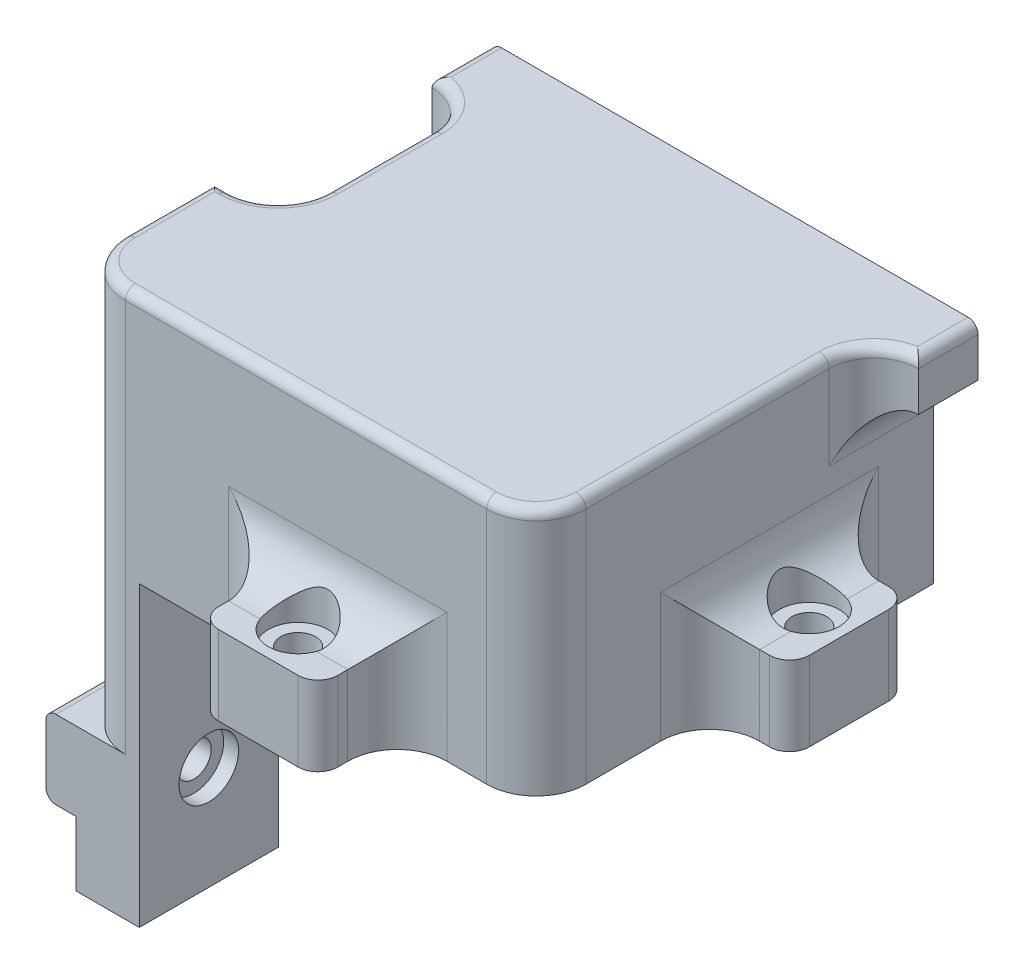
from build123d import *

# Parameters (mm, degrees)
CROQUIS1_W              = 40
CROQUIS1_H              = 40
SALIENTE_EXTRUIR1_DEPTH = 25
CROQUIS3_W              = 30
CROQUIS3_H              = 18
CORTAR_EXTRUIR1_DEPTH   = 30
CROQUIS4_W              = 9
CROQUIS4_H              = 10
SALIENTE_EXTRUIR2_DEPTH = 5
REDONDEO3_R             = 4.5
CROQUIS6_W              = 6.4
CROQUIS6_H              = 14
SALIENTE_EXTRUIR3_DEPTH = 55
CROQUIS7_W              = 14
CROQUIS7_H              = 7.9
SALIENTE_EXTRUIR4_DEPTH = 3
CROQUIS8_R              = 1.75
CORTAR_EXTRUIR2_DEPTH   = 9.4
CROQUIS9_R              = 3
CORTAR_EXTRUIR3_DEPTH   = 1.5
REDONDEO4_R             = 1
CROQUIS10_W             = 8
CROQUIS10_H             = 12
CROQUIS10_W_2           = 12
CROQUIS10_H_2           = 8
SALIENTE_EXTRUIR5_DEPTH = 8
CROQUIS11_R             = 1.75
CORTAR_EXTRUIR4_DEPTH   = 8
CROQUIS12_R             = 3
CORTAR_EXTRUIR5_DEPTH   = 1.5
REDONDEO5_R             = 5
REDONDEO6_R             = 1
REDONDEO7_R             = 2
CROQUIS13_W             = 9
CROQUIS13_H             = 4
CORTAR_EXTRUIR6_DEPTH   = 85.308955633


# Some blends are built 0.0001 mm under size
with BuildPart() as part:
    # Croquis1 → Saliente-Extruir1 (new body)
    with BuildSketch(Plane(origin=(0, 0, 0), x_dir=(1, 0, 0), z_dir=(0, 1, 0))):
        with Locations((20, -20)):
            Rectangle(CROQUIS1_W, CROQUIS1_H)
    extrude(amount=SALIENTE_EXTRUIR1_DEPTH)

    # Croquis3 → Cortar-Extruir1 (cut)
    with BuildSketch(Plane(origin=(0, 0, 0), x_dir=(-1, 0, 0), z_dir=(0, 0, -1))):
        with Locations((-20, 12.5)):
            Rectangle(CROQUIS3_W, CROQUIS3_H)
    extrude(amount=-CORTAR_EXTRUIR1_DEPTH, mode=Mode.SUBTRACT)

    # Croquis4 → Saliente-Extruir2 (add)
    with BuildSketch(Plane(origin=(0, 25, 0), x_dir=(1, 0, 0), z_dir=(0, 1, 0))):
        with Locations((40, -1)):
            Rectangle(CROQUIS4_W, CROQUIS4_H)
        with Locations((0, -1)):
            Rectangle(CROQUIS4_W, CROQUIS4_H)
    extrude(amount=-SALIENTE_EXTRUIR2_DEPTH)

    # Redondeo3
    redondeo3_edges = [part.edges().sort_by_distance(p)[0] for p in [
        (0, 22.5, 6),
        (40, 22.5, 6),
        (0, 20, 3),
        (40, 20, 3),
    ]]
    fillet(redondeo3_edges, radius=REDONDEO3_R - 0.0001)  # a hair under: the kernel refuses the full size

    # Croquis6 → Saliente-Extruir3 (add)
    with BuildSketch(Plane(origin=(0, 25, 0), x_dir=(1, 0, 0), z_dir=(0, 1, 0))):
        with Locations((-3.2, -33)):
            Rectangle(CROQUIS6_W, CROQUIS6_H)
    extrude(amount=-SALIENTE_EXTRUIR3_DEPTH)

    # Croquis7 → Saliente-Extruir4 (add)
    with BuildSketch(Plane.ZY.offset(6.4)):
        with Locations((33, -19.55)):
            Rectangle(CROQUIS7_W, CROQUIS7_H)
    extrude(amount=SALIENTE_EXTRUIR4_DEPTH)

    # Croquis8 → Cortar-Extruir2 (cut)
    with BuildSketch(Plane.ZY.offset(9.4)):
        with Locations((33, -19.55)):
            Circle(CROQUIS8_R)
    extrude(amount=-CORTAR_EXTRUIR2_DEPTH, mode=Mode.SUBTRACT)

    # Croquis9 → Cortar-Extruir3 (cut)
    with BuildSketch(Plane(origin=(0, 0, 0), x_dir=(0, 0, -1), z_dir=(1, 0, 0))):
        with Locations((-33, -19.55)):
            Circle(CROQUIS9_R)
    extrude(amount=-CORTAR_EXTRUIR3_DEPTH, mode=Mode.SUBTRACT)

    # Redondeo4
    redondeo4_edges = [part.edges().sort_by_distance(p)[0] for p in [
        (-9.4, -23.5, 33),
        (-9.4, -15.6, 33),
    ]]
    fillet(redondeo4_edges, radius=REDONDEO4_R)

    # Croquis10 → Saliente-Extruir5 (add)
    with BuildSketch(Plane.XZ):
        with Locations((44, 16.5)):
            Rectangle(CROQUIS10_W, CROQUIS10_H)
        with Locations((20, 44)):
            Rectangle(CROQUIS10_W_2, CROQUIS10_H_2)
    extrude(amount=-SALIENTE_EXTRUIR5_DEPTH)

    # Croquis11 → Cortar-Extruir4 (cut)
    with BuildSketch(Plane.XZ):
        with Locations(Location((44, 16.5, 0), (0, 0, 270))):
            Circle(CROQUIS11_R)
        with Locations(Location((20, 44, 0), (0, 0, 270))):
            Circle(CROQUIS11_R)
    extrude(amount=-CORTAR_EXTRUIR4_DEPTH, mode=Mode.SUBTRACT)

    # Croquis12 → Cortar-Extruir5 (cut)
    with BuildSketch(Plane(origin=(0, 8, 0), x_dir=(1, 0, 0), z_dir=(0, 1, 0))):
        with Locations(Location((44, -16.5, 0), (0, 0, 270))):
            Circle(CROQUIS12_R)
        with Locations(Location((20, -44, 0), (0, 0, 270))):
            Circle(CROQUIS12_R)
    extrude(amount=-CORTAR_EXTRUIR5_DEPTH, mode=Mode.SUBTRACT)

    # Redondeo5
    # the kernel refuses this fillet: 5 mm, written as the material it adds along each edge
    with BuildSketch(Plane(origin=(0, 25, 26), x_dir=(-1, 0, 0), z_dir=(0, -1, 0))) as redondeo5_piece_1_section:
        with BuildLine():
            CenterArc((REDONDEO5_R, REDONDEO5_R), REDONDEO5_R, 180, 90)
            Line((0, REDONDEO5_R), (-REDONDEO5_R * 0.02, REDONDEO5_R))
            Line((-REDONDEO5_R * 0.02, REDONDEO5_R), (-REDONDEO5_R * 0.02, -REDONDEO5_R * 0.02))
            Line((-REDONDEO5_R * 0.02, -REDONDEO5_R * 0.02), (REDONDEO5_R, -REDONDEO5_R * 0.02))
            Line((REDONDEO5_R, -REDONDEO5_R * 0.02), (REDONDEO5_R, 0))
        make_face()
    redondeo5_piece_1 = extrude(amount=25, mode=Mode.PRIVATE)
    redondeo5_piece_1 = split(redondeo5_piece_1, bisect_by=Plane(origin=(0, 12.5, 24.982634351), z_dir=(-1, 0, 0)), keep=Keep.TOP, mode=Mode.PRIVATE)
    add(redondeo5_piece_1)
    with BuildSketch(Plane(origin=(40, 8, 22.5), x_dir=(0, 1, 0), z_dir=(0, 0, -1))) as redondeo5_piece_2_section:
        with BuildLine():
            CenterArc((REDONDEO5_R, REDONDEO5_R), REDONDEO5_R, 180, 90)
            Line((0, REDONDEO5_R), (-REDONDEO5_R * 0.02, REDONDEO5_R))
            Line((-REDONDEO5_R * 0.02, REDONDEO5_R), (-REDONDEO5_R * 0.02, -REDONDEO5_R * 0.02))
            Line((-REDONDEO5_R * 0.02, -REDONDEO5_R * 0.02), (REDONDEO5_R, -REDONDEO5_R * 0.02))
            Line((REDONDEO5_R, -REDONDEO5_R * 0.02), (REDONDEO5_R, 0))
        make_face()
    redondeo5_piece_2 = extrude(amount=12, mode=Mode.PRIVATE)
    redondeo5_piece_2 = redondeo5_piece_2 - Plane(origin=(44, 9.261889054, 16.5), x_dir=(0, 0, 1), z_dir=(0, 1, 0)) * Cylinder(3, 44, mode=Mode.PRIVATE)
    add(redondeo5_piece_2)
    with BuildSketch(Plane(origin=(40, 0, 10.5), x_dir=(0, 0, -1), z_dir=(0, 1, 0)), Plane(origin=(26, 0, 40), x_dir=(1, 0, 0), z_dir=(0, 1, 0))) as redondeo5_piece_3:
        with BuildLine():
            CenterArc((REDONDEO5_R, -REDONDEO5_R), REDONDEO5_R, 90, 90)
            Line((0, -REDONDEO5_R), (-REDONDEO5_R * 0.02, -REDONDEO5_R))
            Line((-REDONDEO5_R * 0.02, -REDONDEO5_R), (-REDONDEO5_R * 0.02, REDONDEO5_R * 0.02))
            Line((-REDONDEO5_R * 0.02, REDONDEO5_R * 0.02), (REDONDEO5_R, REDONDEO5_R * 0.02))
            Line((REDONDEO5_R, REDONDEO5_R * 0.02), (REDONDEO5_R, 0))
        make_face()
    extrude(amount=8)
    with BuildSketch(Plane(origin=(40, 0, 22.5), x_dir=(0, 0, 1), z_dir=(0, 1, 0)), Plane(origin=(14, 0, 40), x_dir=(-1, 0, 0), z_dir=(0, 1, 0))) as redondeo5_piece_4:
        with BuildLine():
            CenterArc((REDONDEO5_R, REDONDEO5_R), REDONDEO5_R, 180, 90)
            Line((0, REDONDEO5_R), (-REDONDEO5_R * 0.02, REDONDEO5_R))
            Line((-REDONDEO5_R * 0.02, REDONDEO5_R), (-REDONDEO5_R * 0.02, -REDONDEO5_R * 0.02))
            Line((-REDONDEO5_R * 0.02, -REDONDEO5_R * 0.02), (REDONDEO5_R, -REDONDEO5_R * 0.02))
            Line((REDONDEO5_R, -REDONDEO5_R * 0.02), (REDONDEO5_R, 0))
        make_face()
    extrude(amount=8)
    with BuildSketch(Plane(origin=(26, 8, 40), x_dir=(0, 1, 0), z_dir=(-1, 0, 0))) as redondeo5_piece_5_section:
        with BuildLine():
            CenterArc((REDONDEO5_R, -REDONDEO5_R), REDONDEO5_R, 90, 90)
            Line((0, -REDONDEO5_R), (-REDONDEO5_R * 0.02, -REDONDEO5_R))
            Line((-REDONDEO5_R * 0.02, -REDONDEO5_R), (-REDONDEO5_R * 0.02, REDONDEO5_R * 0.02))
            Line((-REDONDEO5_R * 0.02, REDONDEO5_R * 0.02), (REDONDEO5_R, REDONDEO5_R * 0.02))
            Line((REDONDEO5_R, REDONDEO5_R * 0.02), (REDONDEO5_R, 0))
        make_face()
    redondeo5_piece_5 = extrude(amount=12, mode=Mode.PRIVATE)
    redondeo5_piece_5 = redondeo5_piece_5 - Plane(origin=(20, 9.261884867, 44), x_dir=(0, 0, 1), z_dir=(0, 1, 0)) * Cylinder(3, 44, mode=Mode.PRIVATE)
    add(redondeo5_piece_5)
    with BuildSketch(Plane(origin=(40, 8, 35), x_dir=(0, 1, 0), z_dir=(0, 0, -1))) as redondeo5_piece_6a_section:
        with BuildLine():
            CenterArc((REDONDEO5_R, REDONDEO5_R), REDONDEO5_R, 180, 90)
            Line((0, REDONDEO5_R), (-REDONDEO5_R * 0.02, REDONDEO5_R))
            Line((-REDONDEO5_R * 0.02, REDONDEO5_R), (-REDONDEO5_R * 0.02, -REDONDEO5_R * 0.02))
            Line((-REDONDEO5_R * 0.02, -REDONDEO5_R * 0.02), (REDONDEO5_R, -REDONDEO5_R * 0.02))
            Line((REDONDEO5_R, -REDONDEO5_R * 0.02), (REDONDEO5_R, 0))
        make_face()
    redondeo5_piece_6a = extrude(amount=24.5, mode=Mode.PRIVATE)
    redondeo5_piece_6a = split(redondeo5_piece_6a, bisect_by=Plane(origin=(41.131975571, 9.131975571, 22.5), z_dir=(0, 0, 1)), keep=Keep.TOP, mode=Mode.PRIVATE)
    with BuildSketch(Plane(origin=(40, 0, 22.5), x_dir=(0, 0, 1), z_dir=(0, 1, 0))) as redondeo5_piece_6b_section:
        with BuildLine():
            CenterArc((REDONDEO5_R, REDONDEO5_R), REDONDEO5_R, 180, 90)
            Line((0, REDONDEO5_R), (-REDONDEO5_R * 0.02, REDONDEO5_R))
            Line((-REDONDEO5_R * 0.02, REDONDEO5_R), (-REDONDEO5_R * 0.02, -REDONDEO5_R * 0.02))
            Line((-REDONDEO5_R * 0.02, -REDONDEO5_R * 0.02), (REDONDEO5_R, -REDONDEO5_R * 0.02))
            Line((REDONDEO5_R, -REDONDEO5_R * 0.02), (REDONDEO5_R, 0))
        make_face()
    redondeo5_piece_6b = extrude(amount=20.5, mode=Mode.PRIVATE)
    redondeo5_piece_6b = split(redondeo5_piece_6b, bisect_by=Plane(origin=(41.131975571, 8, 23.631975571), z_dir=(0, 1, 0)), keep=Keep.TOP, mode=Mode.PRIVATE)
    redondeo5_piece_6 = redondeo5_piece_6a & redondeo5_piece_6b
    add(redondeo5_piece_6)
    with BuildSketch(Plane(origin=(40, 0, 10.5), x_dir=(0, 0, -1), z_dir=(0, 1, 0))) as redondeo5_piece_7a_section:
        with BuildLine():
            CenterArc((REDONDEO5_R, -REDONDEO5_R), REDONDEO5_R, 90, 90)
            Line((0, -REDONDEO5_R), (-REDONDEO5_R * 0.02, -REDONDEO5_R))
            Line((-REDONDEO5_R * 0.02, -REDONDEO5_R), (-REDONDEO5_R * 0.02, REDONDEO5_R * 0.02))
            Line((-REDONDEO5_R * 0.02, REDONDEO5_R * 0.02), (REDONDEO5_R, REDONDEO5_R * 0.02))
            Line((REDONDEO5_R, REDONDEO5_R * 0.02), (REDONDEO5_R, 0))
        make_face()
    redondeo5_piece_7a = extrude(amount=20.5, mode=Mode.PRIVATE)
    redondeo5_piece_7a = split(redondeo5_piece_7a, bisect_by=Plane(origin=(41.131975571, 8, 9.368024429), z_dir=(0, 1, 0)), keep=Keep.TOP, mode=Mode.PRIVATE)
    with BuildSketch(Plane(origin=(40, 8, 22.5), x_dir=(0, 1, 0), z_dir=(0, 0, -1))) as redondeo5_piece_7b_section:
        with BuildLine():
            CenterArc((REDONDEO5_R, REDONDEO5_R), REDONDEO5_R, 180, 90)
            Line((0, REDONDEO5_R), (-REDONDEO5_R * 0.02, REDONDEO5_R))
            Line((-REDONDEO5_R * 0.02, REDONDEO5_R), (-REDONDEO5_R * 0.02, -REDONDEO5_R * 0.02))
            Line((-REDONDEO5_R * 0.02, -REDONDEO5_R * 0.02), (REDONDEO5_R, -REDONDEO5_R * 0.02))
            Line((REDONDEO5_R, -REDONDEO5_R * 0.02), (REDONDEO5_R, 0))
        make_face()
    redondeo5_piece_7b = extrude(amount=24.5, mode=Mode.PRIVATE)
    redondeo5_piece_7b = split(redondeo5_piece_7b, bisect_by=Plane(origin=(41.131975571, 9.131975571, 0), z_dir=(0, 0, 1)), keep=Keep.TOP, mode=Mode.PRIVATE)
    redondeo5_piece_7b = split(redondeo5_piece_7b, bisect_by=Plane(origin=(41.131975571, 9.131975571, 10.5), z_dir=(0, 0, -1)), keep=Keep.TOP, mode=Mode.PRIVATE)
    redondeo5_piece_7 = redondeo5_piece_7a & redondeo5_piece_7b
    add(redondeo5_piece_7)
    with BuildSketch(Plane(origin=(26, 0, 40), x_dir=(1, 0, 0), z_dir=(0, 1, 0))) as redondeo5_piece_8a_section:
        with BuildLine():
            CenterArc((REDONDEO5_R, -REDONDEO5_R), REDONDEO5_R, 90, 90)
            Line((0, -REDONDEO5_R), (-REDONDEO5_R * 0.02, -REDONDEO5_R))
            Line((-REDONDEO5_R * 0.02, -REDONDEO5_R), (-REDONDEO5_R * 0.02, REDONDEO5_R * 0.02))
            Line((-REDONDEO5_R * 0.02, REDONDEO5_R * 0.02), (REDONDEO5_R, REDONDEO5_R * 0.02))
            Line((REDONDEO5_R, REDONDEO5_R * 0.02), (REDONDEO5_R, 0))
        make_face()
    redondeo5_piece_8a = extrude(amount=20.5, mode=Mode.PRIVATE)
    redondeo5_piece_8a = split(redondeo5_piece_8a, bisect_by=Plane(origin=(27.131975571, 8, 41.131975571), z_dir=(0, 1, 0)), keep=Keep.TOP, mode=Mode.PRIVATE)
    with BuildSketch(Plane(origin=(38.5, 8, 40), x_dir=(0, 1, 0), z_dir=(-1, 0, 0))) as redondeo5_piece_8b_section:
        with BuildLine():
            CenterArc((REDONDEO5_R, -REDONDEO5_R), REDONDEO5_R, 90, 90)
            Line((0, -REDONDEO5_R), (-REDONDEO5_R * 0.02, -REDONDEO5_R))
            Line((-REDONDEO5_R * 0.02, -REDONDEO5_R), (-REDONDEO5_R * 0.02, REDONDEO5_R * 0.02))
            Line((-REDONDEO5_R * 0.02, REDONDEO5_R * 0.02), (REDONDEO5_R, REDONDEO5_R * 0.02))
            Line((REDONDEO5_R, REDONDEO5_R * 0.02), (REDONDEO5_R, 0))
        make_face()
    redondeo5_piece_8b = extrude(amount=24.5, mode=Mode.PRIVATE)
    redondeo5_piece_8b = split(redondeo5_piece_8b, bisect_by=Plane(origin=(26, 9.131975571, 41.131975571), z_dir=(1, 0, 0)), keep=Keep.TOP, mode=Mode.PRIVATE)
    redondeo5_piece_8 = redondeo5_piece_8a & redondeo5_piece_8b
    add(redondeo5_piece_8)
    with BuildSketch(Plane(origin=(26, 8, 40), x_dir=(0, 1, 0), z_dir=(-1, 0, 0))) as redondeo5_piece_9a_section:
        with BuildLine():
            CenterArc((REDONDEO5_R, -REDONDEO5_R), REDONDEO5_R, 90, 90)
            Line((0, -REDONDEO5_R), (-REDONDEO5_R * 0.02, -REDONDEO5_R))
            Line((-REDONDEO5_R * 0.02, -REDONDEO5_R), (-REDONDEO5_R * 0.02, REDONDEO5_R * 0.02))
            Line((-REDONDEO5_R * 0.02, REDONDEO5_R * 0.02), (REDONDEO5_R, REDONDEO5_R * 0.02))
            Line((REDONDEO5_R, REDONDEO5_R * 0.02), (REDONDEO5_R, 0))
        make_face()
    redondeo5_piece_9a = extrude(amount=24.5, mode=Mode.PRIVATE)
    redondeo5_piece_9a = split(redondeo5_piece_9a, bisect_by=Plane(origin=(14, 9.131975571, 41.131975571), z_dir=(-1, 0, 0)), keep=Keep.TOP, mode=Mode.PRIVATE)
    with BuildSketch(Plane(origin=(14, 0, 40), x_dir=(-1, 0, 0), z_dir=(0, 1, 0))) as redondeo5_piece_9b_section:
        with BuildLine():
            CenterArc((REDONDEO5_R, REDONDEO5_R), REDONDEO5_R, 180, 90)
            Line((0, REDONDEO5_R), (-REDONDEO5_R * 0.02, REDONDEO5_R))
            Line((-REDONDEO5_R * 0.02, REDONDEO5_R), (-REDONDEO5_R * 0.02, -REDONDEO5_R * 0.02))
            Line((-REDONDEO5_R * 0.02, -REDONDEO5_R * 0.02), (REDONDEO5_R, -REDONDEO5_R * 0.02))
            Line((REDONDEO5_R, -REDONDEO5_R * 0.02), (REDONDEO5_R, 0))
        make_face()
    redondeo5_piece_9b = extrude(amount=20.5, mode=Mode.PRIVATE)
    redondeo5_piece_9b = split(redondeo5_piece_9b, bisect_by=Plane(origin=(12.868024429, 8, 41.131975571), z_dir=(0, 1, 0)), keep=Keep.TOP, mode=Mode.PRIVATE)
    redondeo5_piece_9 = redondeo5_piece_9a & redondeo5_piece_9b
    add(redondeo5_piece_9)
    # the kernel refuses this fillet: 5 mm, written as the material it takes off along each edge
    with BuildSketch(Plane(origin=(-6.4, 25, 40), x_dir=(1, 0, 0), z_dir=(0, -1, 0))) as redondeo5_2_piece_1:
        with BuildLine():
            CenterArc((REDONDEO5_R, -REDONDEO5_R), REDONDEO5_R, 90, 90)
            Line((0, -REDONDEO5_R), (-REDONDEO5_R * 0.02, -REDONDEO5_R))
            Line((-REDONDEO5_R * 0.02, -REDONDEO5_R), (-REDONDEO5_R * 0.02, REDONDEO5_R * 0.02))
            Line((-REDONDEO5_R * 0.02, REDONDEO5_R * 0.02), (REDONDEO5_R, REDONDEO5_R * 0.02))
            Line((REDONDEO5_R, REDONDEO5_R * 0.02), (REDONDEO5_R, 0))
        make_face()
    extrude(amount=40.6, mode=Mode.SUBTRACT)
    with BuildSketch(Plane(origin=(40, 0, 40), x_dir=(-1, 0, 0), z_dir=(0, 1, 0))) as redondeo5_2_piece_2:
        with BuildLine():
            CenterArc((REDONDEO5_R, -REDONDEO5_R), REDONDEO5_R, 90, 90)
            Line((0, -REDONDEO5_R), (-REDONDEO5_R * 0.02, -REDONDEO5_R))
            Line((-REDONDEO5_R * 0.02, -REDONDEO5_R), (-REDONDEO5_R * 0.02, REDONDEO5_R * 0.02))
            Line((-REDONDEO5_R * 0.02, REDONDEO5_R * 0.02), (REDONDEO5_R, REDONDEO5_R * 0.02))
            Line((REDONDEO5_R, REDONDEO5_R * 0.02), (REDONDEO5_R, 0))
        make_face()
    extrude(amount=25, mode=Mode.SUBTRACT)

    # Redondeo6
    # the kernel refuses this fillet: 1 mm, written as the material it takes off along each edge
    with BuildSketch(Plane(origin=(-6.4, 25, 35), x_dir=(1, 0, 0), z_dir=(0, 0, -1))) as redondeo6_piece_1:
        with BuildLine():
            CenterArc((REDONDEO6_R, REDONDEO6_R), REDONDEO6_R, 180, 90)
            Line((0, REDONDEO6_R), (0, 0))
            Line((0, 0), (REDONDEO6_R, 0))
        make_face()
    extrude(amount=11.5, mode=Mode.SUBTRACT)
    with BuildSketch(Plane(origin=(-8.9, 25, 26), x_dir=(0, 0, 1), z_dir=(1, 0, 0))) as redondeo6_piece_2:
        with BuildLine():
            CenterArc((REDONDEO6_R, REDONDEO6_R), REDONDEO6_R, 180, 90)
            Line((0, REDONDEO6_R), (0, 0))
            Line((0, 0), (REDONDEO6_R, 0))
        make_face()
    extrude(amount=3.9, mode=Mode.SUBTRACT)
    with BuildSketch(Plane(origin=(-1.4, 25, 40), x_dir=(0, -1, 0), z_dir=(1, 0, 0))) as redondeo6_piece_3:
        with BuildLine():
            CenterArc((REDONDEO6_R, REDONDEO6_R), REDONDEO6_R, 180, 90)
            Line((0, REDONDEO6_R), (0, 0))
            Line((0, 0), (REDONDEO6_R, 0))
        make_face()
    extrude(amount=36.4, mode=Mode.SUBTRACT)
    with BuildSketch(Plane(origin=(40, 25, 10.4999), x_dir=(-1, 0, 0), z_dir=(0, 0, 1))) as redondeo6_piece_4:
        with BuildLine():
            CenterArc((REDONDEO6_R, REDONDEO6_R), REDONDEO6_R, 180, 90)
            Line((0, REDONDEO6_R), (0, 0))
            Line((0, 0), (REDONDEO6_R, 0))
        make_face()
    extrude(amount=24.5001, mode=Mode.SUBTRACT)
    with BuildSketch(Plane(origin=(35, 25, 35), x_dir=(0, 0, 1), z_dir=(-1, 0, 0))) as redondeo6_piece_5:
        with BuildLine():
            CenterArc((5 - REDONDEO6_R, -REDONDEO6_R), REDONDEO6_R, 0, 90)
            Line((5, -REDONDEO6_R), (5, 0))
            Line((5, 0), (5 - REDONDEO6_R, 0))
        make_face()
    revolve(axis=Axis((35, 25, 35), (0, 1, 0)), revolution_arc=90, mode=Mode.SUBTRACT)
    with BuildSketch(Plane(origin=(-1.4, 25, 35), x_dir=(0, 0, 1), z_dir=(1, 0, 0))) as redondeo6_piece_6:
        with BuildLine():
            CenterArc((5 - REDONDEO6_R, REDONDEO6_R), REDONDEO6_R, 270, 90)
            Line((5 - REDONDEO6_R, 0), (5, 0))
            Line((5, 0), (5, REDONDEO6_R))
        make_face()
    revolve(axis=Axis((-1.4, 25, 35), (0, -1, 0)), revolution_arc=90, mode=Mode.SUBTRACT)
    with BuildSketch(Plane(origin=(-5, 25, 21), x_dir=(1, 0, 0), z_dir=(0, 0, -1))) as redondeo6_piece_7:
        with BuildLine():
            CenterArc((5 + REDONDEO6_R, REDONDEO6_R), REDONDEO6_R, 180, 90)
            Line((5, REDONDEO6_R), (5, 0))
            Line((5, 0), (5 + REDONDEO6_R, 0))
        make_face()
    revolve(axis=Axis((-5, 25, 21), (0, -1, 0)), revolution_arc=90, mode=Mode.SUBTRACT)
    with BuildSketch(Plane(origin=(44.5, 25, -6.5), x_dir=(-1, 0, 0), z_dir=(0, 0, 1))) as redondeo6_piece_8:
        with BuildLine():
            CenterArc((REDONDEO6_R, REDONDEO6_R), REDONDEO6_R, 180, 90)
            Line((0, REDONDEO6_R), (0, 0))
            Line((0, 0), (REDONDEO6_R, 0))
        make_face()
    extrude(amount=15, mode=Mode.SUBTRACT)
    with BuildSketch(Plane(origin=(-4.5, 25, -6.5), x_dir=(1, 0, 0), z_dir=(0, 0, 1))) as redondeo6_piece_9:
        with BuildLine():
            CenterArc((REDONDEO6_R, -REDONDEO6_R), REDONDEO6_R, 90, 90)
            Line((0, -REDONDEO6_R), (0, 0))
            Line((0, 0), (REDONDEO6_R, 0))
        make_face()
    extrude(amount=15, mode=Mode.SUBTRACT)
    with BuildSketch(Plane(origin=(0, 25, 21), x_dir=(1, 0, 0), z_dir=(0, 0, -1))) as redondeo6_piece_10:
        with BuildLine():
            CenterArc((REDONDEO6_R, REDONDEO6_R), REDONDEO6_R, 180, 90)
            Line((0, REDONDEO6_R), (0, 0))
            Line((0, 0), (REDONDEO6_R, 0))
        make_face()
    extrude(amount=10.5001, mode=Mode.SUBTRACT)
    with BuildSketch(Plane(origin=(-4.4999, 25, 10.4999), x_dir=(1, 0, 0), z_dir=(0, 0, 1))) as redondeo6_piece_11:
        with BuildLine():
            CenterArc((4.4999 + REDONDEO6_R, -REDONDEO6_R), REDONDEO6_R, 90, 90)
            Line((4.4999, -REDONDEO6_R), (4.4999, 0))
            Line((4.4999, 0), (4.4999 + REDONDEO6_R, 0))
        make_face()
    revolve(axis=Axis((-4.4999, 25, 10.4999), (0, 1, 0)), revolution_arc=90, mode=Mode.SUBTRACT)
    with BuildSketch(Plane(origin=(44.4999, 25, 10.4999), x_dir=(-1, 0, 0), z_dir=(0, 0, 1))) as redondeo6_piece_12:
        with BuildLine():
            CenterArc((4.4999 + REDONDEO6_R, REDONDEO6_R), REDONDEO6_R, 180, 90)
            Line((4.4999, REDONDEO6_R), (4.4999, 0))
            Line((4.4999, 0), (4.4999 + REDONDEO6_R, 0))
        make_face()
    revolve(axis=Axis((44.4999, 25, 10.4999), (0, -1, 0)), revolution_arc=90, mode=Mode.SUBTRACT)
    with BuildSketch(Plane(origin=(47, 25, 6), x_dir=(0, 0, -1), z_dir=(-1, 0, 0))) as redondeo6_piece_13:
        with BuildLine():
            CenterArc((REDONDEO6_R, REDONDEO6_R), REDONDEO6_R, 180, 90)
            Line((0, REDONDEO6_R), (0, 0))
            Line((0, 0), (REDONDEO6_R, 0))
        make_face()
    extrude(amount=2.5001, mode=Mode.SUBTRACT)
    with BuildSketch(Plane(origin=(-7, 25, 6), x_dir=(0, 0, -1), z_dir=(1, 0, 0))) as redondeo6_piece_14:
        with BuildLine():
            CenterArc((REDONDEO6_R, -REDONDEO6_R), REDONDEO6_R, 90, 90)
            Line((0, -REDONDEO6_R), (0, 0))
            Line((0, 0), (REDONDEO6_R, 0))
        make_face()
    extrude(amount=2.5001, mode=Mode.SUBTRACT)

    # Redondeo7
    redondeo7_edges = [part.edges().sort_by_distance(p)[0] for p in [
        (48, 4, 22.5),
        (48, 4, 10.5),
        (26, 4, 48),
        (14, 4, 48),
    ]]
    fillet(redondeo7_edges, radius=REDONDEO7_R)

    # Croquis13 → Cortar-Extruir6 (cut, through all)
    with BuildSketch(Plane.XZ.offset(-20)):
        with Locations((0, -2)):
            Rectangle(CROQUIS13_W, CROQUIS13_H)
        with Locations((40, -2)):
            Rectangle(CROQUIS13_W, CROQUIS13_H)
    extrude(amount=-CORTAR_EXTRUIR6_DEPTH, mode=Mode.SUBTRACT)


solid = part.part
